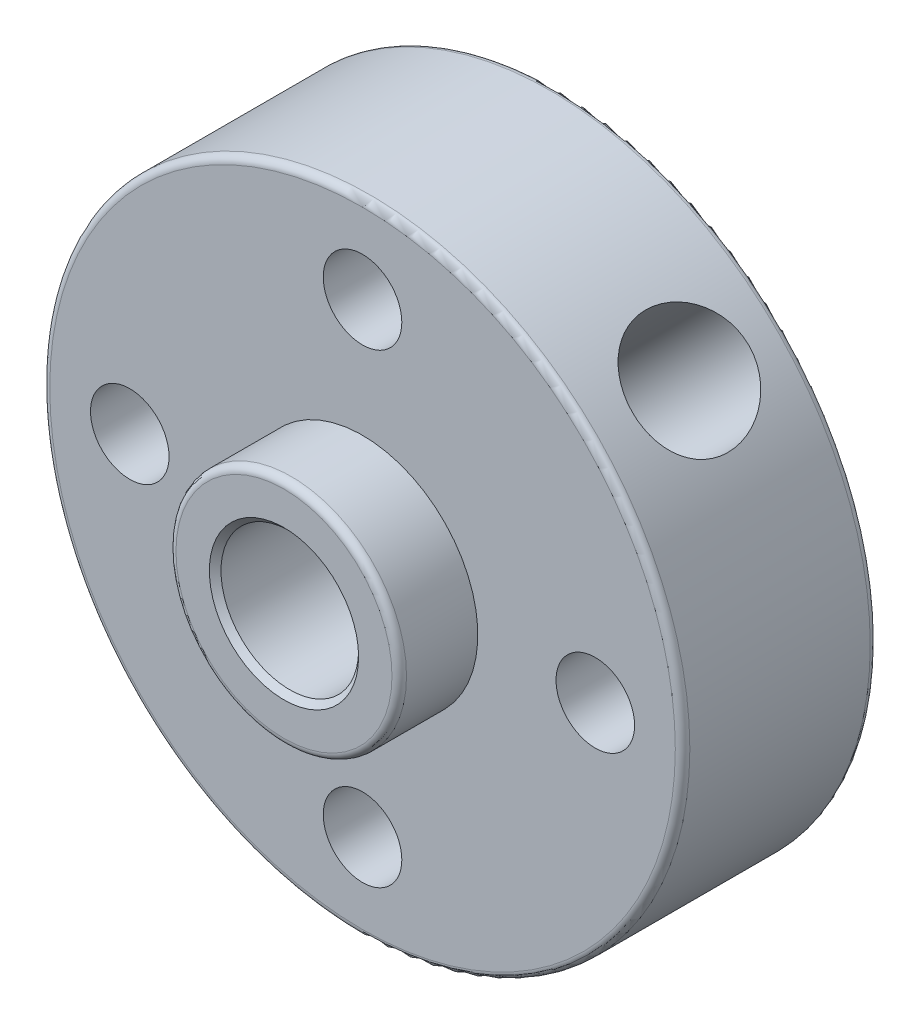
from build123d import *

# Parameters (mm, degrees)
SKETCH1_R           = 11
BOSS_EXTRUDE1_DEPTH = 6.7
SKETCH2_R           = 3.9625
BOSS_EXTRUDE2_DEPTH = 2.7
SKETCH3_R           = 2.365
CUT_EXTRUDE1_DEPTH  = 19.175808098
SKETCH4_R           = 1.35
CUT_EXTRUDE2_DEPTH  = 17.937827488
SKETCH6_R           = 2
CUT_EXTRUDE3_DEPTH  = 17.937827488
CHAMFER1_SIZE       = 0.2
FILLET1_R           = 0.25


with BuildPart() as part:
    # Sketch1 → Boss-Extrude1 (new body)
    with BuildSketch(Plane.XY):
        Circle(SKETCH1_R)
    extrude(amount=-BOSS_EXTRUDE1_DEPTH)

    # Sketch2 → Boss-Extrude2 (add)
    with BuildSketch(Plane.XY):
        Circle(SKETCH2_R)
    extrude(amount=BOSS_EXTRUDE2_DEPTH)

    # Sketch3 → Cut-Extrude1 (cut, through all)
    with BuildSketch(Plane.XY.offset(2.7)):
        Circle(SKETCH3_R)
    extrude(amount=-CUT_EXTRUDE1_DEPTH, mode=Mode.SUBTRACT)

    # Sketch4 → Cut-Extrude2 (cut, through all)
    with BuildSketch(Plane.XY):
        with Locations((0, 8)):
            Circle(SKETCH4_R)
        with Locations((8, 0)):
            Circle(SKETCH4_R)
        with Locations((0, -8)):
            Circle(SKETCH4_R)
        with Locations((-8, 0)):
            Circle(SKETCH4_R)
    extrude(amount=-CUT_EXTRUDE2_DEPTH, mode=Mode.SUBTRACT)

    # Sketch6 → Cut-Extrude3 (cut, through all)
    with BuildSketch(Plane(origin=(0, 0, 0), x_dir=(0, 0, 1), z_dir=(-0.7071067811865487, -0.7071067811865465, 0))):
        with Locations((-3.5, 0)):
            Circle(SKETCH6_R)
    extrude(amount=-CUT_EXTRUDE3_DEPTH, mode=Mode.SUBTRACT)

    # Chamfer1
    chamfer1_edges = [part.edges().sort_by_distance(p)[0] for p in [
        (-2.365, 0, -6.7),
        (-2.365, 0, 2.7),
    ]]
    chamfer(chamfer1_edges, length=CHAMFER1_SIZE)

    # Fillet1
    fillet1_edges = [part.edges().sort_by_distance(p)[0] for p in [
        (-11, 0, -6.7),
        (-11, 0, 0),
        (-3.9625, 0, 2.7),
    ]]
    fillet(fillet1_edges, radius=FILLET1_R)


solid = part.part
